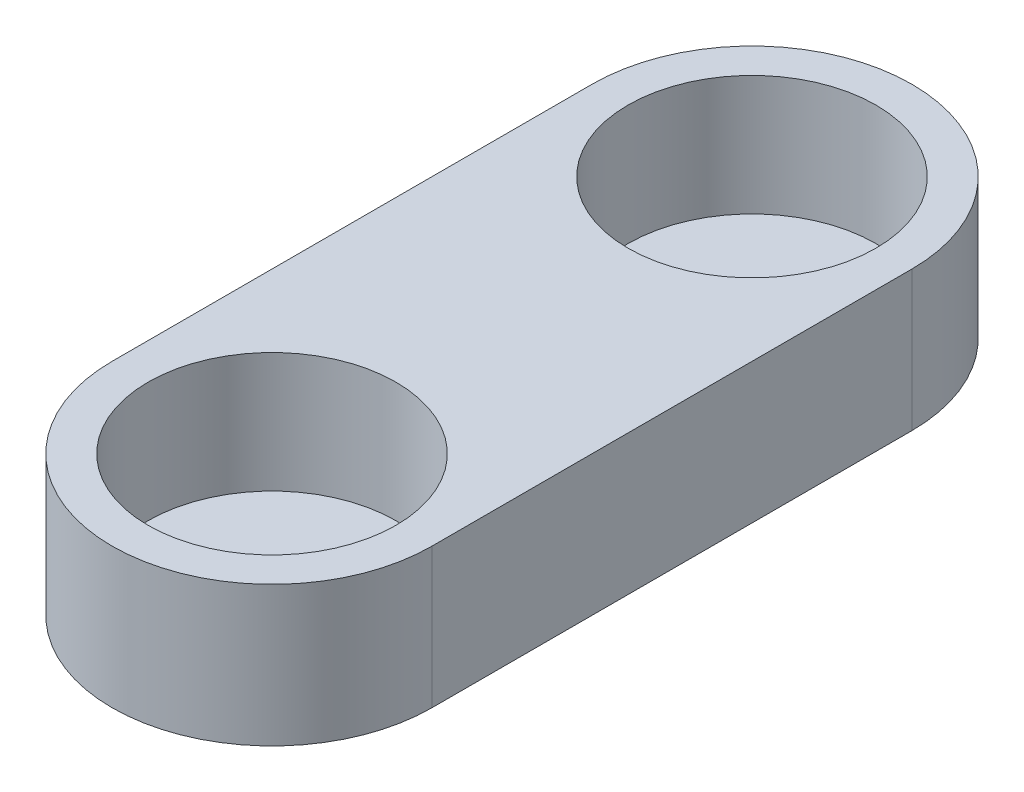
from build123d import *

# Parameters (mm, degrees)
SKETCH1_R           = 3.1
BOSS_EXTRUDE1_DEPTH = 3
BOSS_EXTRUDE2_START = 0.5
BOSS_EXTRUDE2_DEPTH = 0.5
SKETCH3_R           = 0.8
CUT_EXTRUDE1_DEPTH  = 2.5


with BuildPart() as part:
    # Sketch1 → Boss-Extrude1 (new body)
    with BuildSketch(Plane(origin=(0, 0, 0), x_dir=(1, 0, 0), z_dir=(0, 1, 0))):
        with BuildLine():
            Line((4, 6), (4, -6))
            ThreePointArc((4, -6), (0, -10), (-4, -6))
            Line((-4, -6), (-4, 6))
            ThreePointArc((-4, 6), (0, 10), (4, 6))
        make_face()
        with Locations((0, 6)):
            Circle(SKETCH1_R, mode=Mode.SUBTRACT)
        with Locations((0, -6)):
            Circle(SKETCH1_R, mode=Mode.SUBTRACT)
    extrude(amount=BOSS_EXTRUDE1_DEPTH)

    # Sketch2 → Boss-Extrude2 (add)
    with BuildSketch(Plane.XZ.offset(BOSS_EXTRUDE2_START)):
        with BuildLine():
            Line((4, 6), (4, -6))
            ThreePointArc((4, -6), (0, -10), (-4, -6))
            Line((-4, -6), (-4, 6))
            ThreePointArc((-4, 6), (0, 10), (4, 6))
        make_face()
    extrude(amount=-BOSS_EXTRUDE2_DEPTH)

    # Sketch3 → Cut-Extrude1 (cut)
    with BuildSketch(Plane.XZ.offset(0.5)):
        Circle(SKETCH3_R)
    extrude(amount=-CUT_EXTRUDE1_DEPTH, mode=Mode.SUBTRACT)


solid = part.part
